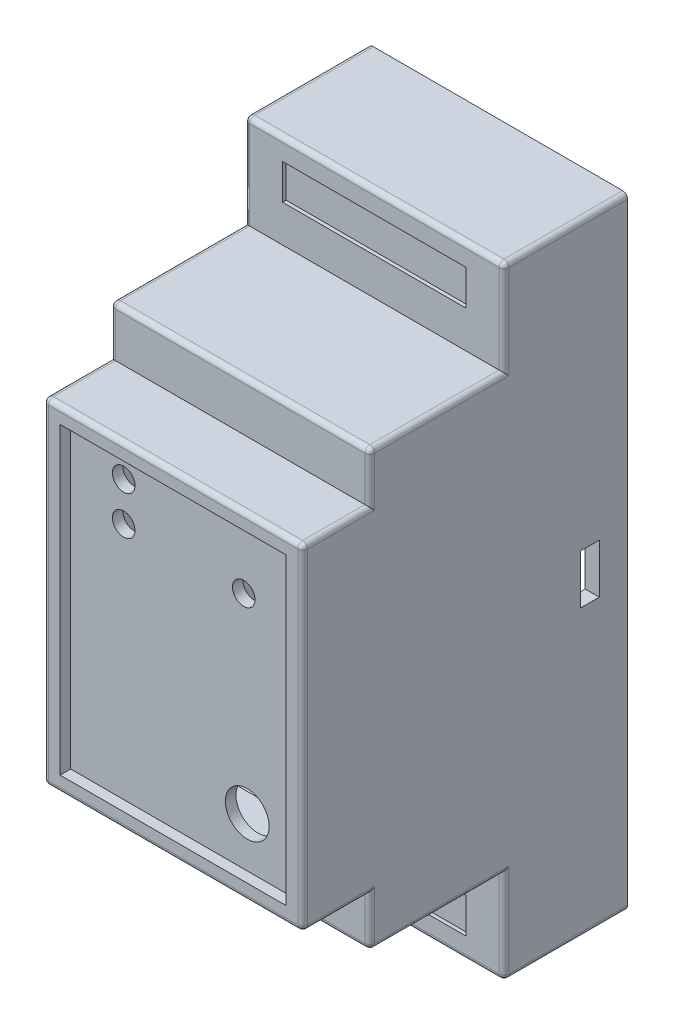
from build123d import *

# Parameters (mm, degrees)
EXTRUDE_1_DEPTH      = 18.35
FILLET_1_R           = 0.7
SHELL_START          = -28.75
SHELL_1_OUTLINE_W    = 32.7
SHELL_1_OUTLINE_H    = 34.5
SHELL_1_DEPTH        = 57.5
SHELL_START_2        = -42
SHELL_1_2_OUTLINE_W  = 32.7
SHELL_1_2_OUTLINE_H  = 15.5
SHELL_1_2_DEPTH      = 84
SHELL_START_3        = -21.75
SHELL_1_3_OUTLINE_W  = 32.7
SHELL_1_3_OUTLINE_H  = 8.5
SHELL_1_3_DEPTH      = 43.5
SKETCH_2_W           = 32
SKETCH_2_H           = 43
CUT_EXTRUDE_1_DEPTH  = 1.5
SKETCH_7_W           = 25.5
SKETCH_7_H           = 2
SKETCH_7_W_2         = 26
CUT_EXTRUDE_5_DEPTH  = 11
SKETCH_8_W           = 2.7
SKETCH_8_H           = 7
CUT_EXTRUDE_6_DEPTH  = 36
SKETCH_9_W           = 26
SKETCH_9_H           = 5
CUT_EXTRUDE_7_DEPTH  = 0.5
SKETCH_10_W          = 34.7
SKETCH_10_H          = 86
SKETCH_10_W_2        = 32.7
SKETCH_10_H_2        = 84
CUT_EXTRUDE_8_DEPTH  = 1.5
SKETCH_11_W          = 2.5
SKETCH_11_H          = 11
CUT_EXTRUDE_9_DEPTH  = 2
SKETCH_12_R          = 1.6
SKETCH_12_R_2        = 3.1
CUT_EXTRUDE_10_DEPTH = 2
EXTRUDE_2_REACH      = 72.956


# Read off the part's stored shape, not the designer's step: Оболочка1
with BuildPart() as part:
    # Эскиз1 → Вытянуть1 (new, symmetric)
    with BuildSketch(Plane(origin=(0, 0, 0), x_dir=(0, 0, -1), z_dir=(1, 0, 0))):
        Polygon((-17.5, -30.75), (-17.5, -44), (0, -44), (0, 44), (-17.5, 44), (-17.5, 30.75), (-36.5, 30.75), (-36.5, 23.75), (-46, 23.75), (-46, -23.75), (-36.5, -23.75), (-36.5, -30.75), align=None)
    extrude(amount=EXTRUDE_1_DEPTH, both=True)

    # Скругление1
    fillet_1_edges = [part.edges().sort_by_distance(p)[0] for p in [
        (18.35, 37.375, 17.5),
        (-18.35, -37.375, 17.5),
        (-18.35, -30.75, 27),
        (-18.35, -27.25, 36.5),
        (-18.35, -23.75, 41.25),
        (-18.35, 0, 46),
        (-18.35, 23.75, 41.25),
        (-18.35, 27.25, 36.5),
        (-18.35, 30.75, 27),
        (18.35, 30.75, 27),
        (-18.35, 37.375, 17.5),
        (-18.35, 44, 8.75),
        (18.35, 27.25, 36.5),
        (0, -44, 17.5),
        (0, -30.75, 36.5),
        (0, -23.75, 46),
        (0, 23.75, 46),
        (18.35, 23.75, 41.25),
        (0, 30.75, 36.5),
        (0, 44, 17.5),
        (18.35, 0, 46),
        (18.35, -23.75, 41.25),
        (18.35, -27.25, 36.5),
        (18.35, -30.75, 27),
        (18.35, -37.375, 17.5),
        (18.35, -44, 8.75),
        (18.35, 44, 8.75),
        (-18.35, -44, 8.75),
    ]]
    fillet(fillet_1_edges, radius=FILLET_1_R)

    # Оболочка1 outline → Оболочка1 (cut)
    with BuildSketch(Plane(origin=(0, 0, 0), x_dir=(1, 0, 0), z_dir=(0, 1, 0)).offset(SHELL_START)):
        with Locations((0, -17.25)):
            Rectangle(SHELL_1_OUTLINE_W, SHELL_1_OUTLINE_H)
    extrude(amount=SHELL_1_DEPTH, mode=Mode.SUBTRACT)

    # Shell 1 2 outline → Shell 1 2 (cut)
    with BuildSketch(Plane(origin=(0, 0, 0), x_dir=(1, 0, 0), z_dir=(0, 1, 0)).offset(SHELL_START_2)):
        with Locations((0, -7.75)):
            Rectangle(SHELL_1_2_OUTLINE_W, SHELL_1_2_OUTLINE_H)
    extrude(amount=SHELL_1_2_DEPTH, mode=Mode.SUBTRACT)

    # Shell 1 3 outline → Shell 1 3 (cut)
    with BuildSketch(Plane(origin=(0, 0, 0), x_dir=(1, 0, 0), z_dir=(0, 1, 0)).offset(SHELL_START_3)):
        with Locations((0, -38.75)):
            Rectangle(SHELL_1_3_OUTLINE_W, SHELL_1_3_OUTLINE_H)
    extrude(amount=SHELL_1_3_DEPTH, mode=Mode.SUBTRACT)

    # Эскиз2 → Вырез-Вытянуть1 (cut)
    with BuildSketch(Plane.XY.offset(46)):
        Rectangle(SKETCH_2_W, SKETCH_2_H)
    extrude(amount=-CUT_EXTRUDE_1_DEPTH, mode=Mode.SUBTRACT)

    # Эскиз7 → Вырез-Вытянуть5 (cut)
    with BuildSketch(Plane(origin=(0, 0, 0), x_dir=(-1, 0, 0), z_dir=(0, 0, -1))):
        with Locations((0, -43)):
            Rectangle(SKETCH_7_W, SKETCH_7_H)
        with Locations((0, 43)):
            Rectangle(SKETCH_7_W_2, SKETCH_7_H)
    extrude(amount=-CUT_EXTRUDE_5_DEPTH, mode=Mode.SUBTRACT)

    # Эскиз8 → Вырез-Вытянуть6 (cut, symmetric)
    with BuildSketch(Plane(origin=(0, 0, 0), x_dir=(0, 0, -1), z_dir=(1, 0, 0))):
        with Locations((-5.35, 0)):
            Rectangle(SKETCH_8_W, SKETCH_8_H)
    extrude(amount=CUT_EXTRUDE_6_DEPTH, both=True, mode=Mode.SUBTRACT)

    # Эскиз9 → Вырез-Вытянуть7 (cut)
    with BuildSketch(Plane.XY.offset(17.5)):
        with Locations((0, 38.5)):
            Rectangle(SKETCH_9_W, SKETCH_9_H)
    cut_extrude_7 = extrude(amount=-CUT_EXTRUDE_7_DEPTH, mode=Mode.SUBTRACT)

    # Зеркальное отражение1: Вырез-Вытянуть7 across plane
    add(cut_extrude_7.mirror(Plane.ZX), mode=Mode.SUBTRACT)

    # Эскиз10 → Вырез-Вытянуть8 (cut)
    with BuildSketch(Plane(origin=(0, 0, 0), x_dir=(-1, 0, 0), z_dir=(0, 0, -1))):
        Rectangle(SKETCH_10_W, SKETCH_10_H)
        Rectangle(SKETCH_10_W_2, SKETCH_10_H_2, mode=Mode.SUBTRACT)
    extrude(amount=-CUT_EXTRUDE_8_DEPTH, mode=Mode.SUBTRACT)

    # Эскиз11 → Вырез-Вытянуть9 (cut)
    with BuildSketch(Plane.XZ.offset(44)):
        with Locations((-14, 5.5)):
            Rectangle(SKETCH_11_W, SKETCH_11_H)
    extrude(amount=-CUT_EXTRUDE_9_DEPTH, mode=Mode.SUBTRACT)

    # Эскиз12 → Вырез-Вытянуть10 (cut)
    with BuildSketch(Plane.XY.offset(44.5)):
        with Locations((-8.5, 17.790145453)):
            Circle(SKETCH_12_R)
        with Locations((-8.5, 12.29)):
            Circle(SKETCH_12_R)
        with Locations((8.5, 12.29)):
            Circle(SKETCH_12_R)
        with Locations((9, -14.5)):
            Circle(SKETCH_12_R_2)
    extrude(amount=-CUT_EXTRUDE_10_DEPTH, mode=Mode.SUBTRACT)

    # Эскиз13 → Вытянуть2 (add, up to next)
    with BuildSketch(Plane(origin=(-13, 0, 0), x_dir=(0, 0, -1), z_dir=(1, 0, 0)), mode=Mode.PRIVATE) as extrude_2_sk1:
        Polygon((-11, 44), (-11, 42), (-1.508482634, 42), (-1.5, 43), (0, 43), (0, 44), align=None)
    extrude_2_tool1 = extrude(extrude_2_sk1.sketch, amount=EXTRUDE_2_REACH, mode=Mode.PRIVATE) - part.part
    add(extrude_2_tool1.solids().sort_by_distance((-13, 43.036731, 5.84846))[0])


solid = part.part
